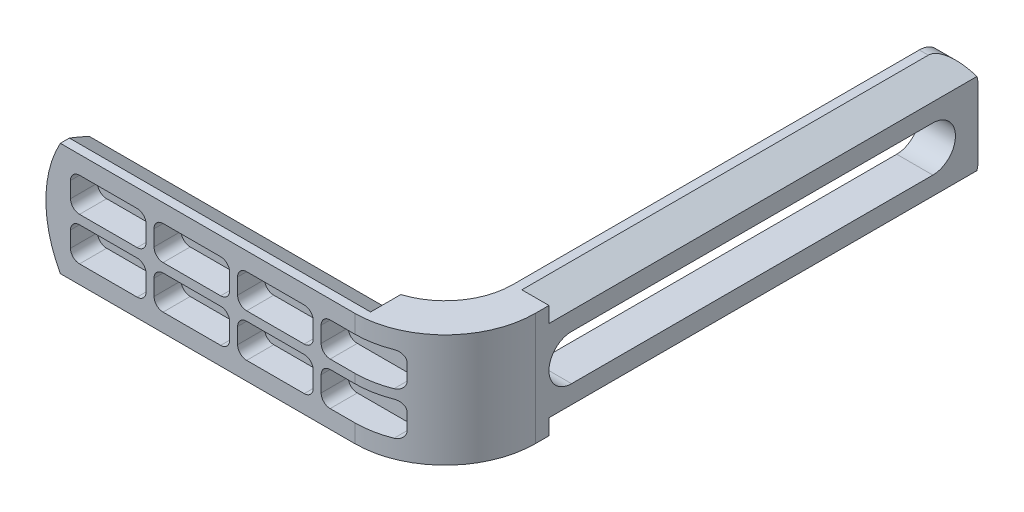
from build123d import *

# Parameters (mm, degrees)
SKETCH_1_W                     = 88.5
SKETCH_1_H                     = 25
EXTRUDE_1_DEPTH                = 8
CUT_EXTRUDE_2_DEPTH            = 70
SKETCH_9_W                     = 16.75
SKETCH_9_H                     = 7.5
CUT_EXTRUDE_3_DEPTH            = 6
FILLET_4_R                     = 2
PATTERN_LINEAR_1_COUNT         = 4
PATTERN_LINEAR_1_PITCH         = 18.5
PATTERN_LINEAR_1_COUNT_DIR2    = 2
PATTERN_LINEAR_1_PITCH_DIR2    = 9.5
FILLET_4_OF_PATTERN_LINEAR_1_R = 2
SKETCH_10_W                    = 8
SKETCH_10_H                    = 25
EXTRUDE_2_DEPTH                = 110
FILLET_5_R                     = 20
FILLET_6_R                     = 15
FILLET_7_R                     = 5
CUT_EXTRUDE_4_DEPTH            = 95
CUT_EXTRUDE_5_REACH            = 145.378
CUT_EXTRUDE_7_REACH            = 145.378


with BuildPart() as part:
    # Эскиз1 → Бобышка-Вытянуть1 (new body)
    with BuildSketch(Plane.XY):
        with Locations((44.25, 12.5)):
            Rectangle(SKETCH_1_W, SKETCH_1_H)
    extrude(amount=EXTRUDE_1_DEPTH)

    # Эскиз4 → Вырез-Вытянуть2 (cut)
    with BuildSketch(Plane.ZY):
        Polygon((6, 0), (0, 3.464101615), (0, 0), align=None)
        Polygon((0, 25), (6, 25), (0, 21.535898385), align=None)
    extrude(amount=-CUT_EXTRUDE_2_DEPTH, mode=Mode.SUBTRACT)

    # Эскиз9 → Вырез-Вытянуть3 (cut)
    with BuildSketch(Plane.XY.offset(8)):
        with Locations((13.928226592, 17.25)):
            Rectangle(SKETCH_9_W, SKETCH_9_H)
    cut_extrude_3 = extrude(amount=-CUT_EXTRUDE_3_DEPTH, mode=Mode.SUBTRACT)

    # Скругление4
    fillet_4_edges = [part.edges().sort_by_distance(p)[0] for p in [
        (22.303226592, 13.5, 5),
        (22.303226592, 21, 5),
        (5.553226592, 21, 5),
        (5.553226592, 13.5, 5),
    ]]
    fillet(fillet_4_edges, radius=FILLET_4_R)

    # Линейный массив1: Cut-Extrude 3 4 × 2
    with Locations(*[(i * PATTERN_LINEAR_1_PITCH, -j * PATTERN_LINEAR_1_PITCH_DIR2, 0) for i in range(PATTERN_LINEAR_1_COUNT) for j in range(PATTERN_LINEAR_1_COUNT_DIR2) if (i, j) != (0, 0)]):
        add(cut_extrude_3, mode=Mode.SUBTRACT)

    # Скругление4 of Линейный массив1
    fillet_4_of_pattern_linear_1_edges = [part.edges().sort_by_distance(p)[0] for p in [
        (22.303226592, 4, 5),
        (22.303226592, 11.5, 5),
        (5.553226592, 11.5, 5),
        (5.553226592, 4, 5),
        (40.803226592, 13.5, 5),
        (40.803226592, 21, 5),
        (24.053226592, 21, 5),
        (24.053226592, 13.5, 5),
        (40.803226592, 4, 5),
        (40.803226592, 11.5, 5),
        (24.053226592, 11.5, 5),
        (24.053226592, 4, 5),
        (59.303226592, 13.5, 5),
        (59.303226592, 21, 5),
        (42.553226592, 21, 5),
        (42.553226592, 13.5, 5),
        (59.303226592, 4, 5),
        (59.303226592, 11.5, 5),
        (42.553226592, 11.5, 5),
        (42.553226592, 4, 5),
        (77.803226592, 13.5, 5),
        (77.803226592, 21, 5),
        (61.053226592, 21, 5),
        (61.053226592, 13.5, 5),
        (77.803226592, 4, 5),
        (77.803226592, 11.5, 5),
        (61.053226592, 11.5, 5),
        (61.053226592, 4, 5),
    ]]
    fillet(fillet_4_of_pattern_linear_1_edges, radius=FILLET_4_OF_PATTERN_LINEAR_1_R)

    # Эскиз10 → Бобышка-Вытянуть2 (add)
    with BuildSketch(Plane(origin=(0, 0, 0), x_dir=(-1, 0, 0), z_dir=(0, 0, -1))):
        with Locations((-84.5, 12.5)):
            Rectangle(SKETCH_10_W, SKETCH_10_H)
    extrude(amount=EXTRUDE_2_DEPTH)

    # Скругление5
    # the kernel refuses this fillet: 20 mm, written as the material it takes off along each edge
    with BuildSketch(Plane(origin=(88.5, -50, 8), x_dir=(-1, 0, 0), z_dir=(0, 1, 0))) as fillet_5_piece_1:
        with BuildLine():
            CenterArc((FILLET_5_R, -FILLET_5_R), FILLET_5_R, 90, 90)
            Line((0, -FILLET_5_R), (0, 0))
            Line((0, 0), (FILLET_5_R, 0))
        make_face()
    extrude(amount=125, mode=Mode.SUBTRACT)

    # Скругление6
    fillet_6_edges = [part.edges().sort_by_distance(p)[0] for p in [
        (80.5, 12.5, 0),
    ]]
    fillet(fillet_6_edges, radius=FILLET_6_R)

    # Скругление7
    fillet_7_edges = [part.edges().sort_by_distance(p)[0] for p in [
        (84.5, 0, -110),
        (84.5, 25, -110),
    ]]
    fillet(fillet_7_edges, radius=FILLET_7_R)

    # Эскиз11 → Вырез-Вытянуть4 (cut)
    with BuildSketch(Plane(origin=(0, 0, -110), x_dir=(-1, 0, 0), z_dir=(0, 0, -1))):
        Polygon((-82.5, 25), (-88.5, 25), (-88.5, 21.535898385), align=None)
        Polygon((-88.5, 3.464101615), (-82.5, 0), (-88.5, 0), align=None)
    extrude(amount=-CUT_EXTRUDE_4_DEPTH, mode=Mode.SUBTRACT)

    # Эскиз12 → Вырез-Вытянуть5 (cut, up to next)
    with BuildSketch(Plane(origin=(88.5, 0, 0), x_dir=(0, 0, -1), z_dir=(1, 0, 0)), mode=Mode.PRIVATE) as cut_extrude_5_sk1:
        with BuildLine():
            Line((20, 17.5), (100, 17.5))
            ThreePointArc((100, 17.5), (105, 12.5), (100, 7.5))
            Line((100, 7.5), (20, 7.5))
            ThreePointArc((20, 7.5), (15, 12.5), (20, 17.5))
        make_face()
    cut_extrude_5_tool1 = extrude(cut_extrude_5_sk1.sketch, amount=-CUT_EXTRUDE_5_REACH, mode=Mode.PRIVATE) & part.part
    add(cut_extrude_5_tool1.solids().sort_by_distance((88.5, 12.5, -60))[0], mode=Mode.SUBTRACT)

    # Эскиз13 → Вырез-Вытянуть7 (cut, up to next)
    with BuildSketch(Plane(origin=(0, 0, 0), x_dir=(-1, 0, 0), z_dir=(0, 0, -1)), mode=Mode.PRIVATE) as cut_extrude_7_sk1:
        with BuildLine():
            Line((-3.30197377, 25), (0, 25))
            Line((0, 25), (0, 0))
            Line((0, 0), (-3.30197377, 0))
            ThreePointArc((-3.30197377, 0), (-0.1, 12.5), (-3.30197377, 25))
        make_face()
    cut_extrude_7_tool1 = extrude(cut_extrude_7_sk1.sketch, amount=-CUT_EXTRUDE_7_REACH, mode=Mode.PRIVATE) & part.part
    add(cut_extrude_7_tool1.solids().sort_by_distance((1.650987, 24.747829, 0))[0], mode=Mode.SUBTRACT)


solid = part.part
